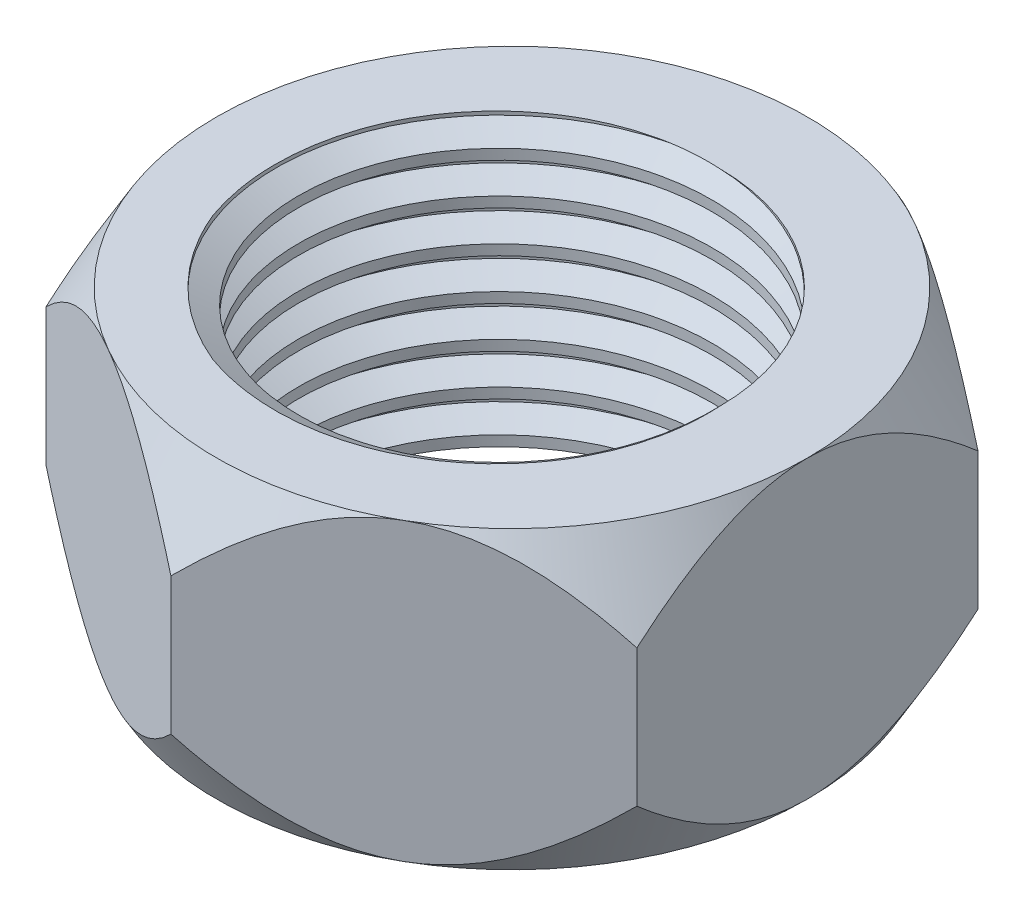
from build123d import *

# Parameters (mm, degrees)
BOSS_EXTRUDE1_DEPTH = 25
SKETCH2_OUTSIDE_W   = 121.932
SKETCH2_OUTSIDE_H   = 129.668
SKETCH2_OUTSIDE_R   = 25
CUT_EXTRUDE1_DEPTH  = 46.643546459
CUT_EXTRUDE1_DRAFT  = -30
SKETCH3_OUTSIDE_W   = 121.932
SKETCH3_OUTSIDE_H   = 129.668
SKETCH3_OUTSIDE_R   = 25
CUT_EXTRUDE2_DEPTH  = 46.643546459
CUT_EXTRUDE2_DRAFT  = -30
SKETCH4_R           = 17.5
CUT_EXTRUDE3_DEPTH  = 46.643546459
THREAD1_PITCH       = 3.5


with BuildPart() as part:
    # Sketch1 → Boss-Extrude1 (new body)
    with BuildSketch(Plane(origin=(0, 0, 0), x_dir=(1, 0, 0), z_dir=(0, 1, 0))):
        Polygon((0, 28.867513459), (-25, 14.43375673), (-25, -14.43375673), (0, -28.867513459), (25, -14.43375673), (25, 14.43375673), align=None)
    extrude(amount=BOSS_EXTRUDE1_DEPTH)


with BuildPart() as cut_extrude1_tool:
    # Sketch2 outside → Cut-Extrude1 (with draft: the straight prism first)
    with BuildSketch(Plane(origin=(0, 25, 0), x_dir=(1, 0, 0), z_dir=(0, 1, 0))):
        Rectangle(SKETCH2_OUTSIDE_W, SKETCH2_OUTSIDE_H)
        Circle(SKETCH2_OUTSIDE_R, mode=Mode.SUBTRACT)
    extrude(amount=-CUT_EXTRUDE1_DEPTH)
    # Cut-Extrude1: the draft: its side faces are tilted about the plane it starts from
    cut_extrude1_sides = [cut_extrude1_tool.faces().sort_by_distance(p)[0] for p in [
        (0, 1.678226771, 64.834),
        (60.966, 1.678226771, 0),
        (0, 1.678226771, -64.834),
        (-60.966, 1.678226771, 0),
        (-25, 1.678226771, 0),
    ]]
    draft(cut_extrude1_sides, Plane(origin=(0, 25, 0), x_dir=(1, 0, 0), z_dir=(0, 1, 0)), CUT_EXTRUDE1_DRAFT)


with BuildPart() as part_1:
    add(part.part)

    # Cut-Extrude1: cut by cut_extrude1_tool
    add(cut_extrude1_tool.part, mode=Mode.SUBTRACT)


with BuildPart() as cut_extrude2_tool:
    # Sketch3 outside → Cut-Extrude2 (with draft: the straight prism first)
    with BuildSketch(Plane.XZ):
        Rectangle(SKETCH3_OUTSIDE_W, SKETCH3_OUTSIDE_H)
        Circle(SKETCH3_OUTSIDE_R, mode=Mode.SUBTRACT)
    extrude(amount=-CUT_EXTRUDE2_DEPTH)
    # Cut-Extrude2: the draft: its side faces are tilted about the plane it starts from
    cut_extrude2_sides = [cut_extrude2_tool.faces().sort_by_distance(p)[0] for p in [
        (0, 23.321773229, -64.834),
        (60.966, 23.321773229, 0),
        (0, 23.321773229, 64.834),
        (-60.966, 23.321773229, 0),
        (-25, 23.321773229, 0),
    ]]
    draft(cut_extrude2_sides, Plane.XZ, CUT_EXTRUDE2_DRAFT)


with BuildPart() as part_2:
    add(part_1.part)

    # Cut-Extrude2: cut by cut_extrude2_tool
    add(cut_extrude2_tool.part, mode=Mode.SUBTRACT)

    # Sketch4 → Cut-Extrude3 (cut, through all)
    with BuildSketch(Plane.XZ):
        with Locations(Location((0, 0, 0), (0, 0, 270))):
            Circle(SKETCH4_R)
    extrude(amount=-CUT_EXTRUDE3_DEPTH, mode=Mode.SUBTRACT)

    # Thread1: the profile of Thread Profile1 profile screwed along a right-hand helix of 8 turns, 12 arcs to a turn; built about Z, then put on its axis
    thread1_z = Axis((0, 0, 0), (0, 0, 1))
    thread1_corners = [(17.4997, 0, -0.000173205), (19.394430563, 0, 1.093749995), (19.394430563, 0, 1.531249995), (17.4997, 0, 2.625173196)]
    with BuildLine(mode=Mode.PRIVATE) as thread1_profile:
        Line(thread1_corners[0], thread1_corners[1])
        Line(thread1_corners[1], thread1_corners[2])
        Line(thread1_corners[2], thread1_corners[3])
        Line(thread1_corners[3], thread1_corners[0])
    thread1_cap = Face(thread1_profile.wire())
    thread1_turn_angles = [0, 15, 30, 45, 60, 75, 90, 105, 120, 135, 150, 165, 180, 195, 210, 225, 240, 255, 270, 285, 300, 315, 330, 345, 360]
    thread1_turn_weights = [1, 0.9659258262890683, 1, 0.9659258262890683, 1, 0.9659258262890683, 1, 0.9659258262890683, 1, 0.9659258262890683, 1, 0.9659258262890683, 1, 0.9659258262890683, 1, 0.9659258262890683, 1, 0.9659258262890683, 1, 0.9659258262890683, 1, 0.9659258262890683, 1, 0.9659258262890683, 1]
    thread1_turn_rails = [Edge.make_bspline([Vector(p[0], p[1], 0).rotate(thread1_z, thread1_turn_angles[k]) / thread1_turn_weights[k] + Vector(0, 0, p[2] + THREAD1_PITCH * thread1_turn_angles[k] / 360) for k in range(25)], [0, 0, 0, 1, 1, 2, 2, 3, 3, 4, 4, 5, 5, 6, 6, 7, 7, 8, 8, 9, 9, 10, 10, 11, 11, 12, 12, 12], 2, thread1_turn_weights) for p in thread1_corners]
    thread1_turn_sides = [Face.make_surface_from_curves(thread1_turn_rails[p[0]], thread1_turn_rails[p[1]]) for p in [(0, 1), (1, 2), (2, 3), (3, 0)]]
    thread1 = Plane(origin=(0, -3, 0), x_dir=(1, 0, 0), z_dir=(0, 1, 0)) * Solid(Shell([*[p.moved(Location((0, 0, THREAD1_PITCH * i))) for i in range(8) for p in thread1_turn_sides], thread1_cap, thread1_cap.rotate(thread1_z, 2880).moved(Location((0, 0, THREAD1_PITCH * 2880 / 360)))]))
    add(thread1, mode=Mode.SUBTRACT)


solid = part_2.part
